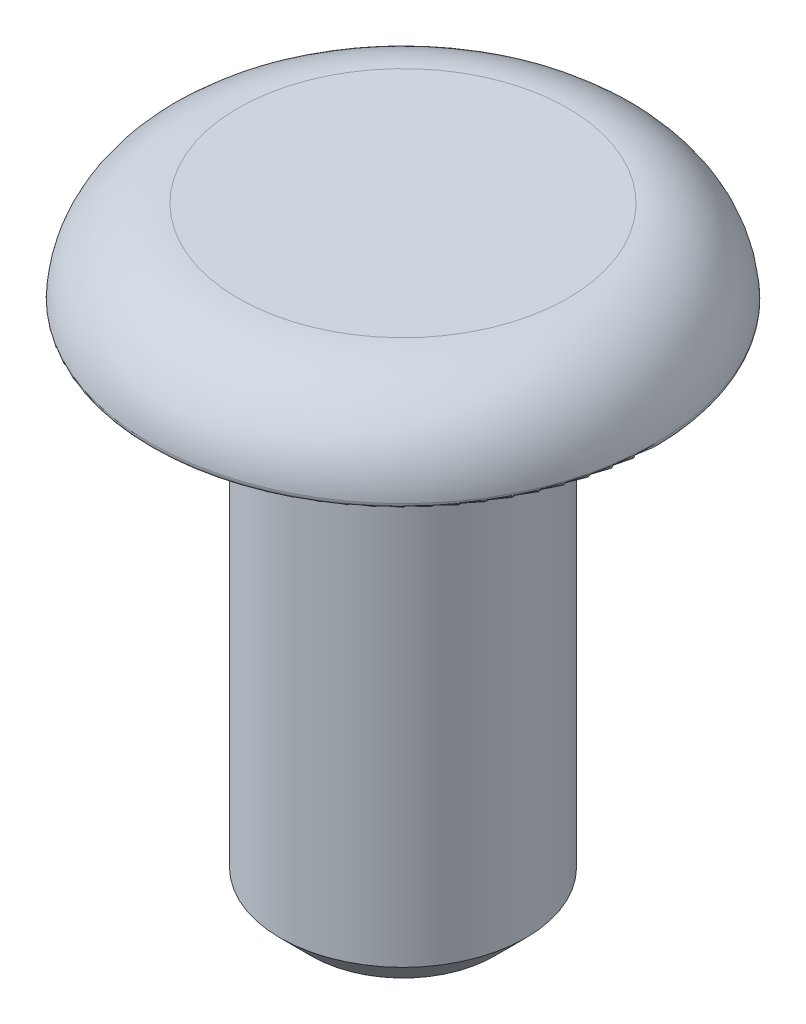
from build123d import *

# Parameters (mm, degrees)
SKETCH1_R           = 1.11125
BOSS_EXTRUDE1_DEPTH = 4.699
SKETCH2_R           = 2.286
BOSS_EXTRUDE2_DEPTH = 0.79375
FILLET1_R           = 0.79375
FILLET2_R           = 0.049609375
CHAMFER1_SIZE       = 0.28575


with BuildPart() as part:
    # Sketch1 → Boss-Extrude1 (new body)
    with BuildSketch(Plane(origin=(0, 0, 0), x_dir=(1, 0, 0), z_dir=(0, 1, 0))):
        with Locations(Location((0, 0, 0), (0, 0, 270))):
            Circle(SKETCH1_R)
    extrude(amount=BOSS_EXTRUDE1_DEPTH)

    # Sketch2 → Boss-Extrude2 (add)
    with BuildSketch(Plane(origin=(0, 4.699, 0), x_dir=(1, 0, 0), z_dir=(0, 1, 0))):
        with Locations(Location((0, 0, 0), (0, 0, 270))):
            Circle(SKETCH2_R)
    extrude(amount=BOSS_EXTRUDE2_DEPTH)

    # Fillet1
    fillet1_edges = [part.edges().sort_by_distance(p)[0] for p in [
        (0, 5.49275, -2.286),
    ]]
    fillet(fillet1_edges, radius=FILLET1_R - 0.0001)  # a hair under: the kernel refuses the full size

    # Fillet2
    fillet2_edges = [part.edges().sort_by_distance(p)[0] for p in [
        (0, 4.699, -2.286),
    ]]
    fillet(fillet2_edges, radius=FILLET2_R)

    # Chamfer1
    chamfer1_edges = [part.edges().sort_by_distance(p)[0] for p in [
        (0, 0, -1.11125),
    ]]
    chamfer(chamfer1_edges, length=CHAMFER1_SIZE)


solid = part.part
